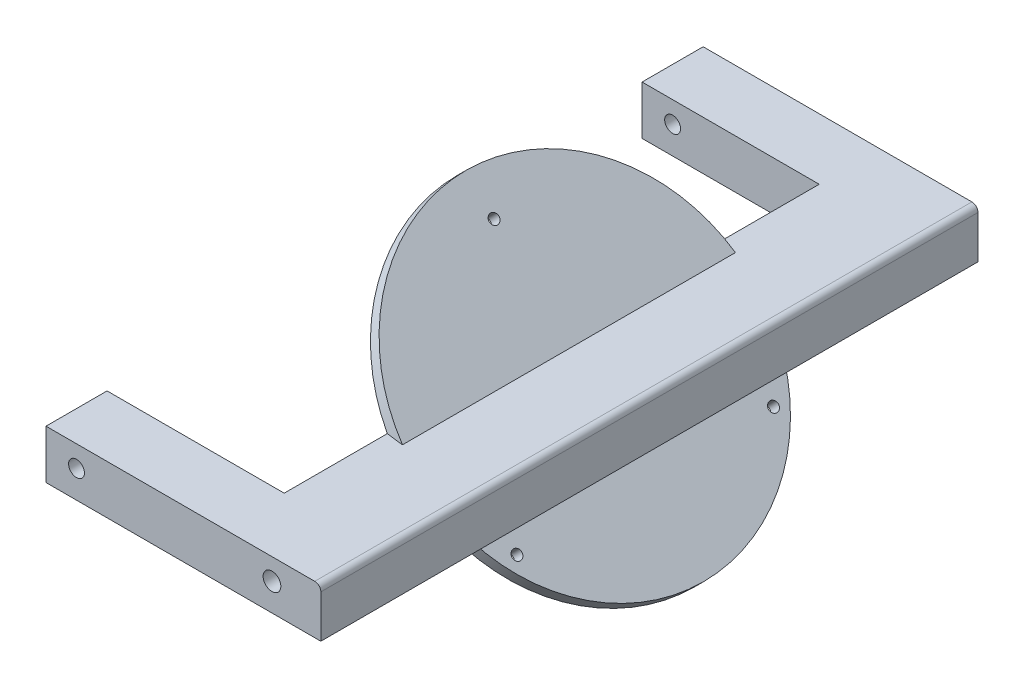
from build123d import *

# Parameters (mm, degrees)
BASE_DEPTH            = 53.8
SKETCH4_R             = 27.5
BOSS_EXTRUDE2_DEPTH   = 2
M2X0_4_TAPPED_HOLE1_D = 1.6
FILLET1_R             = 0.5
SIDE_HOLES_D          = 2.9
SIDE_ARM_DEPTH        = 10
M2_CLEARANCE_HOLE1_D  = 2.6
FILLET2_R             = 1


with BuildPart() as part:
    # Sketch1 → Base (new, symmetric)
    with BuildSketch(Plane.XY):
        Polygon((8, 4), (-8, 4), (0, -4), (8, -4), align=None)
    extrude(amount=BASE_DEPTH, both=True)

    # Sketch4 → Boss-Extrude2 (add)
    with BuildSketch(Plane(origin=(-2, -2, 0), x_dir=(0, 0, 1), z_dir=(-0.7071067811865475, -0.7071067811865476, 0))):
        with Locations((0, 2.828427125)):
            Circle(SKETCH4_R)
    extrude(amount=-BOSS_EXTRUDE2_DEPTH)

    # M2x0.4 Tapped Hole1 (through all)
    with Locations(Plane(origin=(-0.585786438, -0.585786438, 0), x_dir=(0.7071067811865475, -0.7071067811865477, 0), z_dir=(0.7071067811865477, 0.7071067811865475, 0))):
        with Locations((-23.828427125, 0), (11.171572875, 21), (11.171572875, -21)):
            Hole(M2X0_4_TAPPED_HOLE1_D / 2)

    # Sketch8 → Revolve1 (revolve)
    with BuildSketch(Plane(origin=(-2, 2, 0), x_dir=(0, 0, 1), z_dir=(0.7071067811865437, -0.7071067811865515, 0))):
        with BuildLine():
            Line((0, 3.828427125), (0, 2.828427125))
            Line((0, 2.828427125), (-12, 2.828427125))
            Line((-12, 2.828427125), (-6.5, 10.328427125))
            ThreePointArc((-6.5, 10.328427125), (-4.596194078, 5.732233047), (0, 3.828427125))
        make_face()
    revolve(axis=Axis((-4, 0, 0), (-0.7071067811865515, -0.7071067811865437, 0)))

    # Fillet1
    fillet1_edges = [part.edges().sort_by_distance(p)[0] for p in [
        (-9.303300859, -5.303300859, 6.5),
    ]]
    fillet(fillet1_edges, radius=FILLET1_R)

    # Side Holes (through all)
    with Locations(Plane.XY.offset(53.8)):
        with Locations((0, 0.5)):
            Hole(SIDE_HOLES_D / 2)

    # Sketch9 → Side Arm (add)
    with BuildSketch(Plane.XY.offset(53.8)):
        Polygon((-8, 4), (0, -4), (-37, -4), (-37, 4), align=None)
    side_arm = extrude(amount=-SIDE_ARM_DEPTH)

    # Mirror1: Side Arm across plane
    add(side_arm.mirror(Plane.XY))

    # M2 Clearance Hole1 (through all)
    with Locations(Plane.XY.offset(53.8)):
        with Locations((-32, 0.5)):
            Hole(M2_CLEARANCE_HOLE1_D / 2)

    # Fillet2
    fillet2_edges = [part.edges().sort_by_distance(p)[0] for p in [
        (8, 4, 0),
    ]]
    fillet(fillet2_edges, radius=FILLET2_R)


solid = part.part
